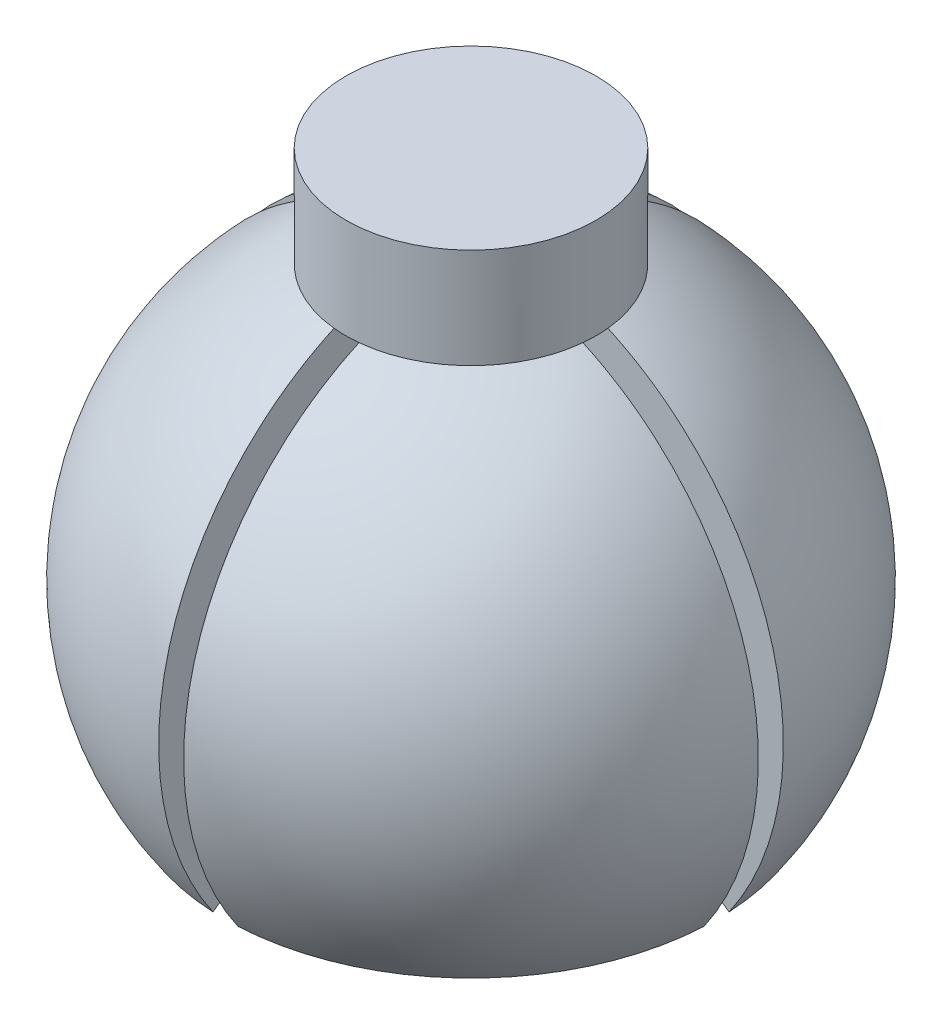
from build123d import *
from build123d.topology import SkipClean

# Parameters (mm, degrees)
SKETCH2_W          = 0.5
SKETCH2_H          = 8.895814675
CUT_EXTRUDE1_DEPTH = 10
CIRPATTERN1_COUNT  = 4


with BuildPart() as part:
    # Sketch1 → Revolve1 (revolve)
    with BuildSketch(Plane.XY):
        with BuildLine():
            Line((0, 7.454356057), (0, 5))
            ThreePointArc((0, 5), (4.435054166, 2.308743066), (4.095760221, -2.867882182))
            Line((4.095760221, -2.867882182), (4.914912266, -3.441458618))
            ThreePointArc((4.914912266, -3.441458618), (5.790432683, 1.571906275), (2.5, 5.454356057))
            Line((2.5, 5.454356057), (2.5, 7.454356057))
            Line((2.5, 7.454356057), (0, 7.454356057))
        make_face()
    revolve(axis=Axis((0, 7.454356057, 0), (0, -1, 0)))

    # Sketch2 → Cut-Extrude1 (cut)
    with BuildSketch(Plane.XY):
        with Locations((0, 1.006448719)):
            Rectangle(SKETCH2_W, SKETCH2_H)
    cut_extrude1 = extrude(amount=-CUT_EXTRUDE1_DEPTH, mode=Mode.SUBTRACT)

    # CirPattern1: Cut-Extrude1 ×4 about axis
    with SkipClean():  # the faces are left unmerged after this step: merging them gives an invalid solid
        cirpattern1_axis = Axis((0, -3.441458618, 0), (0, 1, 0))
        for i in range(1, CIRPATTERN1_COUNT):
            add(cut_extrude1.rotate(cirpattern1_axis, i * 360 / CIRPATTERN1_COUNT), mode=Mode.SUBTRACT)


solid = part.part
